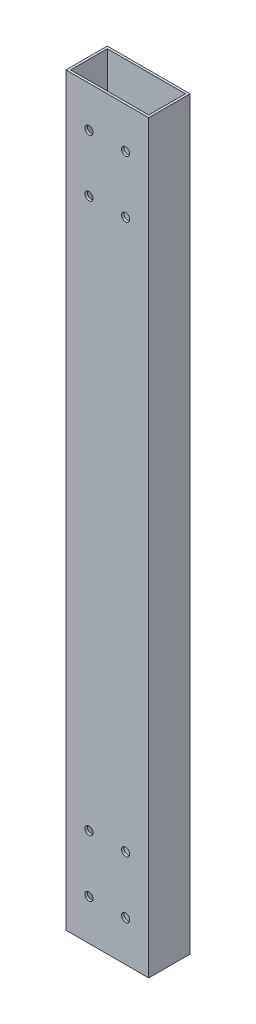
from build123d import *

# Parameters (mm, degrees)
SKETCH1_W           = 50.8
SKETCH1_H           = 25.4
SKETCH1_W_2         = 47.9
SKETCH1_H_2         = 22.5
BOSS_EXTRUDE1_DEPTH = 457.2
SKETCH2_R           = 2.5
CUT_EXTRUDE1_DEPTH  = 459.795739545


with BuildPart() as part:
    # Sketch1 → Boss-Extrude1 (new body)
    with BuildSketch(Plane(origin=(0, 0, 0), x_dir=(1, 0, 0), z_dir=(0, 1, 0))):
        Rectangle(SKETCH1_W, SKETCH1_H)
        Rectangle(SKETCH1_W_2, SKETCH1_H_2, mode=Mode.SUBTRACT)
    extrude(amount=BOSS_EXTRUDE1_DEPTH)

    # Sketch2 → Cut-Extrude1 (cut, through all)
    with BuildSketch(Plane.XY.offset(15.875)):
        with Locations((-11.25, 60)):
            Circle(SKETCH2_R)
        with Locations((-11.25, 25)):
            Circle(SKETCH2_R)
        with Locations((11.25, 25)):
            Circle(SKETCH2_R)
        with Locations((11.25, 60)):
            Circle(SKETCH2_R)
    cut_extrude1 = extrude(amount=-CUT_EXTRUDE1_DEPTH, mode=Mode.SUBTRACT)

    # Mirror1: Cut-Extrude1 across plane
    add(cut_extrude1.mirror(Plane(origin=(0, 228.6, 0), x_dir=(0, 0, 1), z_dir=(0, -1, 0))), mode=Mode.SUBTRACT)


solid = part.part
